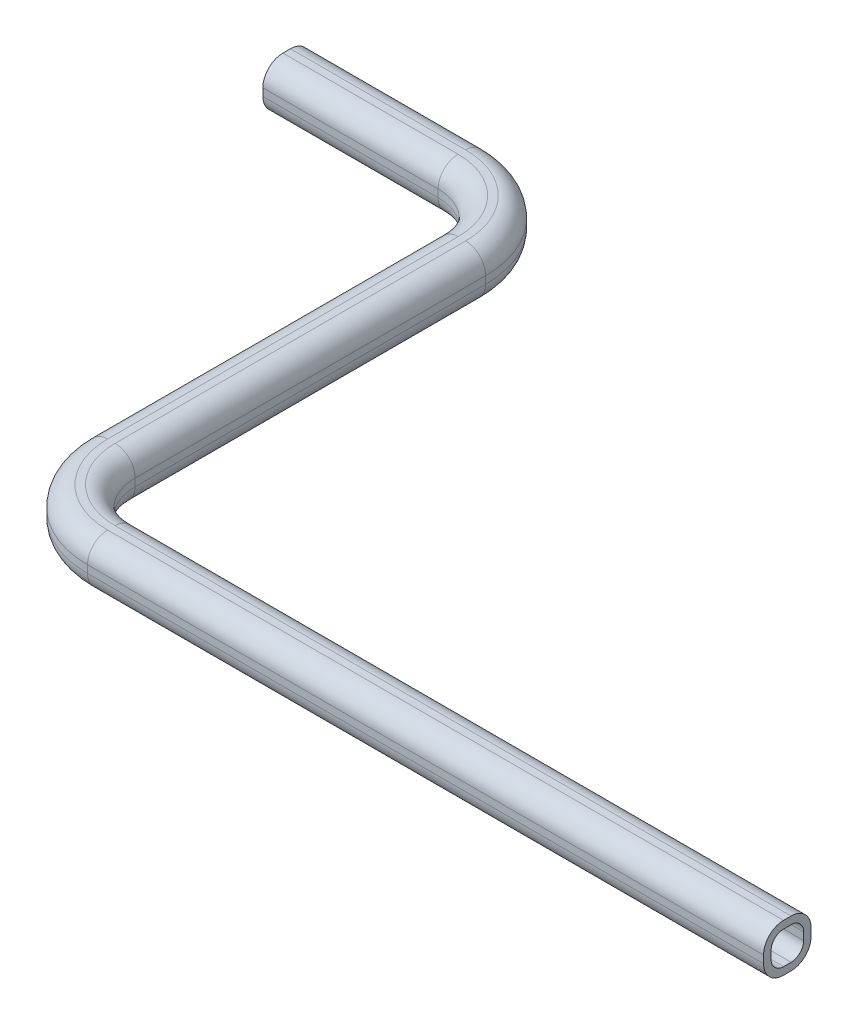
from build123d import *


with BuildPart() as part:
    # Sweep-Thin1: sweep along a path in Sketch1
    with BuildLine(Plane(origin=(0, 0, 0), x_dir=(1, 0, 0), z_dir=(0, 1, 0))) as sweep_thin1_path:
        Line((0, 0), (-270, 0))
        ThreePointArc((-270, 0), (-291.213203436, 8.786796564), (-300, 30))
        Line((-300, 30), (-300, 170))
        ThreePointArc((-300, 170), (-308.786796564, 191.213203436), (-330, 200))
        Line((-330, 200), (-400, 200))
    # Sketch2 → Sweep-Thin1 (sweep)
    with BuildSketch(Plane(origin=(0, 0, 0), x_dir=(0, 0, -1), z_dir=(1, 0, 0))):
        with BuildLine():
            Line((1.5, 9.5), (-1.5, 9.5))
            ThreePointArc((-1.5, 9.5), (-7.156854249, 7.156854249), (-9.5, 1.5))
            Line((-9.5, 1.5), (-9.5, -1.5))
            ThreePointArc((-9.5, -1.5), (-7.156854249, -7.156854249), (-1.5, -9.5))
            Line((-1.5, -9.5), (1.5, -9.5))
            ThreePointArc((1.5, -9.5), (7.156854249, -7.156854249), (9.5, -1.5))
            Line((9.5, -1.5), (9.5, 1.5))
            ThreePointArc((9.5, 1.5), (7.156854249, 7.156854249), (1.5, 9.5))
        make_face()
        with BuildLine():
            Line((1.5, 6.5), (-1.5, 6.5))
            ThreePointArc((-1.5, 6.5), (-5.035533906, 5.035533906), (-6.5, 1.5))
            Line((-6.5, 1.5), (-6.5, -1.5))
            ThreePointArc((-6.5, -1.5), (-5.035533906, -5.035533906), (-1.5, -6.5))
            Line((-1.5, -6.5), (1.5, -6.5))
            ThreePointArc((1.5, -6.5), (5.035533906, -5.035533906), (6.5, -1.5))
            Line((6.5, -1.5), (6.5, 1.5))
            ThreePointArc((6.5, 1.5), (5.035533906, 5.035533906), (1.5, 6.5))
        make_face(mode=Mode.SUBTRACT)
    sweep(path=sweep_thin1_path.line)


solid = part.part
